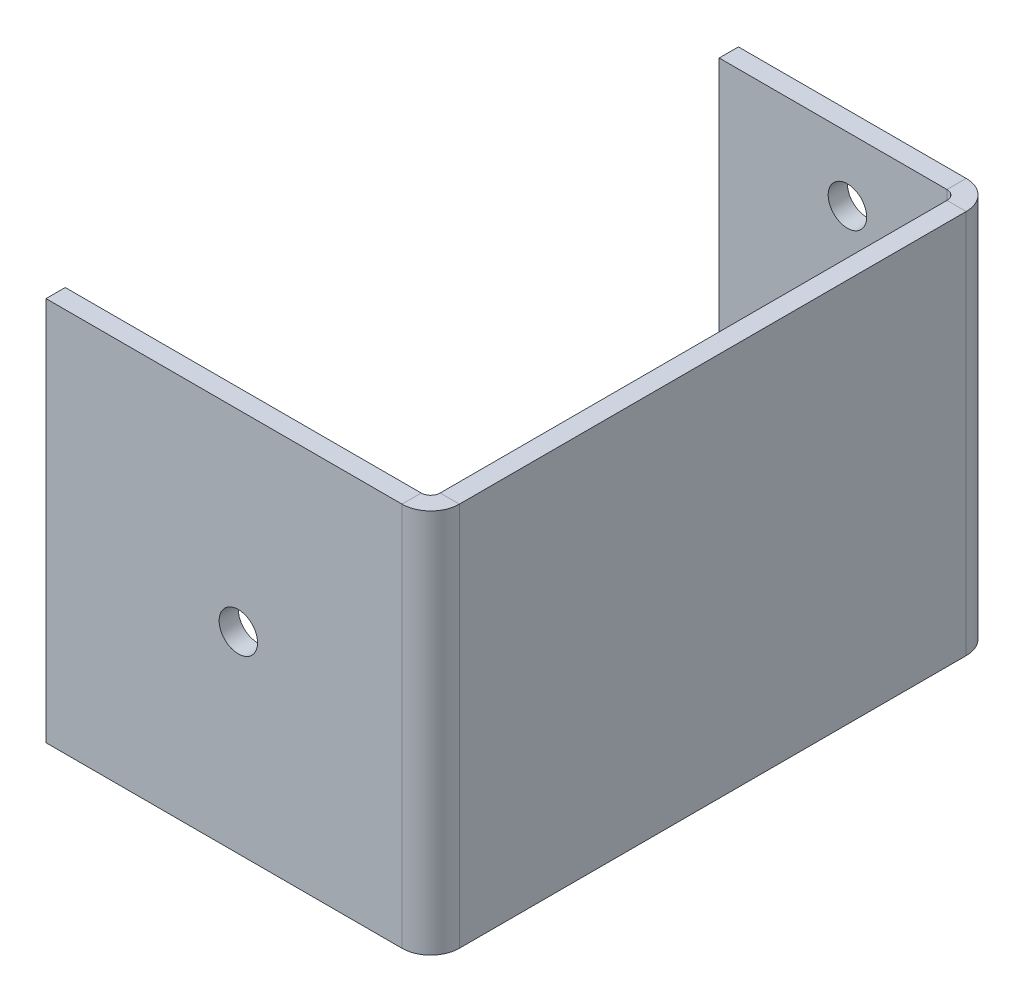
from build123d import *

# Parameters (mm, degrees)
BASE_FLANGE1_DEPTH                     = 30
F_3_0MM_TRANSITIONAL_DOWEL_HOLE1_D     = 3
F_3_0MM_TRANSITIONAL_DOWEL_HOLE1_DEPTH = 1.5
F_3_0MM_TRANSITIONAL_DOWEL_HOLE2_D     = 3
F_3_0MM_TRANSITIONAL_DOWEL_HOLE2_DEPTH = 1.5
F_3_0MM_PRESS_DOWEL_HOLE1_D            = 3
F_3_0MM_PRESS_DOWEL_HOLE1_DEPTH        = 6
F_3_0MM_PRESS_DOWEL_HOLE1_TIP          = 0.901290929


# Sheet-metal steps are written as plain solids
with BuildPart() as part:
    # Sketch1 → Base-Flange1 (new body)
    with BuildSketch(Plane(origin=(0, 0, 0), x_dir=(1, 0, 0), z_dir=(0, 1, 0))):
        with BuildLine():
            Line((0, 0), (17.7634, 0))
            ThreePointArc((17.7634, 0), (19.344915027, -0.655084973), (20, -2.2366))
            Line((20, -2.2366), (20, -41.7634))
            ThreePointArc((20, -41.7634), (19.344915027, -43.344915027), (17.7634, -44))
            Line((17.7634, -44), (-10, -44))
            Line((-10, -44), (-10, -42.5))
            Line((-10, -42.5), (17.7634, -42.5))
            ThreePointArc((17.7634, -42.5), (18.284254855, -42.284254855), (18.5, -41.7634))
            Line((18.5, -41.7634), (18.5, -2.2366))
            ThreePointArc((18.5, -2.2366), (18.284254855, -1.715745145), (17.7634, -1.5))
            Line((17.7634, -1.5), (0, -1.5))
            Line((0, -1.5), (0, 0))
        make_face()
    extrude(amount=BASE_FLANGE1_DEPTH)

    # Ø3.0mm Transitional Dowel Hole1
    with Locations(Plane(origin=(0, 0, 0), x_dir=(-1, 0, 0), z_dir=(0, 0, -1))):
        with Locations((-10, 25), (-10, 5)):
            Hole(F_3_0MM_TRANSITIONAL_DOWEL_HOLE1_D / 2, depth=F_3_0MM_TRANSITIONAL_DOWEL_HOLE1_DEPTH)

    # Ø3.0mm Transitional Dowel Hole2
    with Locations(Plane.XY.offset(44)):
        with Locations((5, 15)):
            Hole(F_3_0MM_TRANSITIONAL_DOWEL_HOLE2_D / 2, depth=F_3_0MM_TRANSITIONAL_DOWEL_HOLE2_DEPTH)

    # Ø3.0mm Press Dowel Hole1
    with Locations(Plane(origin=(146.531359221, 116.2862719, -6), x_dir=(0, -1, 0), z_dir=(0, 0, -1))):
        with Locations((220.525513363, 156.531359221), (102.525513363, 181.531359221), (102.525513363, 271.531359221), (89.19270005, 226.531359221), (210.525513363, 317.793651488), (230.525513363, 317.793651488), (252.525513363, 320.462332131), (232.525513363, 300.462332131), (252.525513363, 132.600386311), (232.525513363, 152.600386311), (111.286271896, 136.531359221), (91.286271896, 136.531359221), (41.525513363, 196.432813402), (13.525513363, 196.432813402), (41.525513363, 138.767959221), (13.525513363, 138.767959221), (41.525513363, 256.62990504), (13.525513363, 256.62990504), (41.525513363, 314.294759221), (13.525513363, 314.294759221)):
            Hole(F_3_0MM_PRESS_DOWEL_HOLE1_D / 2, depth=F_3_0MM_PRESS_DOWEL_HOLE1_DEPTH)
            with Locations((0, 0, -(F_3_0MM_PRESS_DOWEL_HOLE1_DEPTH + F_3_0MM_PRESS_DOWEL_HOLE1_TIP / 2))):  # 118° drill point
                Cone(0, F_3_0MM_PRESS_DOWEL_HOLE1_D / 2, F_3_0MM_PRESS_DOWEL_HOLE1_TIP, mode=Mode.SUBTRACT)


solid = part.part
